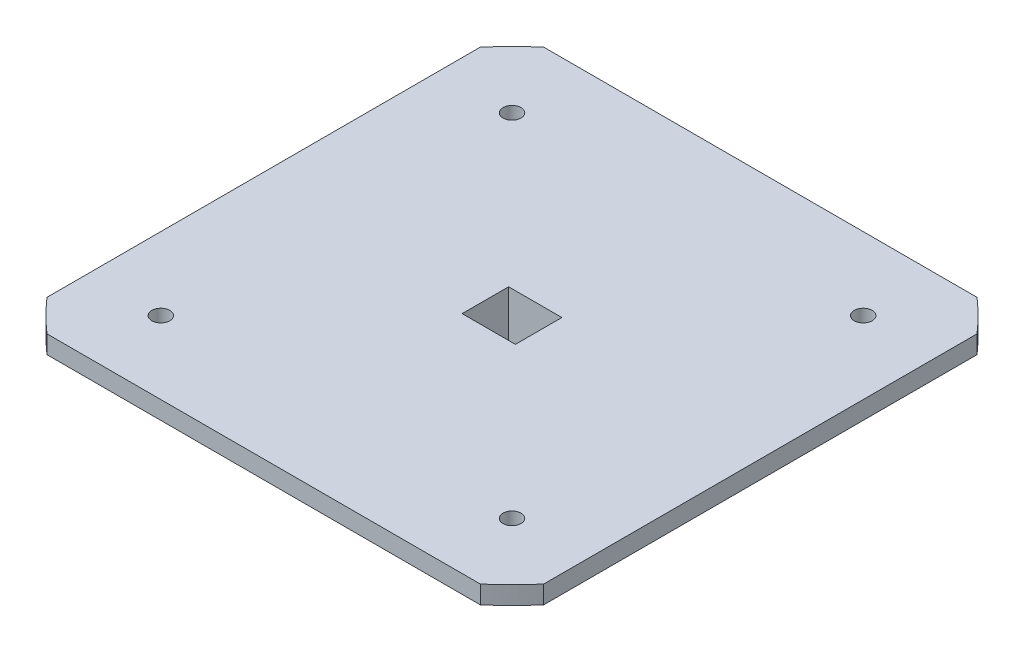
from build123d import *

# Parameters (mm, degrees)
BOSS_EXTRUDE1_DEPTH       = 4
F_4_0MM_DOWEL_HOLE2_D     = 4
SKETCH7_W                 = 11.8
SKETCH7_H                 = 10.3
CUT_EXTRUDE1_DEPTH        = 10
SKETCH8_W                 = 21.8
SKETCH8_H                 = 20.3
SKETCH8_W_2               = 11.8
SKETCH8_H_2               = 10.3
BOSS_EXTRUDE2_DEPTH       = 12
FILLET1_START             = -10.15
FILLET1_DEPTH             = 20.3
FILLET1_START_2           = -12
FILLET1_2_DEPTH           = 24
F_3_0MM_DOWEL_HOLE1_D     = 3
F_3_0MM_DOWEL_HOLE1_DEPTH = 5


with BuildPart() as part:
    # Sketch1 → Boss-Extrude1 (new body)
    with BuildSketch(Plane(origin=(0, 0, 0), x_dir=(1, 0, 0), z_dir=(0, 1, 0))):
        with BuildLine():
            Line((55, 48), (55, -48))
            ThreePointArc((55, -48), (51.618795027, -51.618795027), (48, -55))
            Line((48, -55), (-48, -55))
            ThreePointArc((-48, -55), (-51.618795027, -51.618795027), (-55, -48))
            Line((-55, -48), (-55, 48))
            ThreePointArc((-55, 48), (-51.618795027, 51.618795027), (-48, 55))
            Line((-48, 55), (48, 55))
            ThreePointArc((48, 55), (51.618795027, 51.618795027), (55, 48))
        make_face()
    extrude(amount=BOSS_EXTRUDE1_DEPTH)

    # Ø4.0mm Dowel Hole2 (through all)
    with Locations(Plane(origin=(0, 4, 0), x_dir=(1, 0, 0), z_dir=(0, 1, 0))):
        with Locations((38.890872965, 38.890872965), (38.890872965, -38.890872965), (-38.890872965, -38.890872965), (-38.890872965, 38.890872965)):
            Hole(F_4_0MM_DOWEL_HOLE2_D / 2)

    # Sketch7 → Cut-Extrude1 (cut)
    with BuildSketch(Plane.XZ):
        Rectangle(SKETCH7_W, SKETCH7_H)
    extrude(amount=-CUT_EXTRUDE1_DEPTH, mode=Mode.SUBTRACT)

    # Sketch8 → Boss-Extrude2 (add)
    with BuildSketch(Plane.XZ):
        Rectangle(SKETCH8_W, SKETCH8_H)
        Rectangle(SKETCH8_W_2, SKETCH8_H_2, mode=Mode.SUBTRACT)
    extrude(amount=BOSS_EXTRUDE2_DEPTH)

    # Fillet1: read off the stored shape, not the designer's step
    # Fillet1 outline → Fillet1 (cut)
    with BuildSketch(Plane.XY.offset(FILLET1_START)):
        with BuildLine():
            Line((10.9, -12), (10.9, -7))
            ThreePointArc((10.9, -7), (9.435533906, -10.535533906), (5.9, -12))
            Line((5.9, -12), (10.9, -12))
        make_face()
        with BuildLine():
            Line((-10.9, -12), (-5.9, -12))
            ThreePointArc((-5.9, -12), (-9.435533906, -10.535533906), (-10.9, -7))
            Line((-10.9, -7), (-10.9, -12))
        make_face()
    extrude(amount=FILLET1_DEPTH, mode=Mode.SUBTRACT)

    # Fillet1 2 outline → Fillet1 2 (cut)
    with BuildSketch(Plane.YZ.offset(FILLET1_START_2)):
        with BuildLine():
            ThreePointArc((-12, 5.15), (-10.535533906, 8.685533906), (-7, 10.15))
            Line((-7, 10.15), (-12, 10.15))
            Line((-12, 10.15), (-12, 5.15))
        make_face()
        with BuildLine():
            Line((-12, -10.15), (-7, -10.15))
            ThreePointArc((-7, -10.15), (-10.535533906, -8.685533906), (-12, -5.15))
            Line((-12, -5.15), (-12, -10.15))
        make_face()
    extrude(amount=FILLET1_2_DEPTH, mode=Mode.SUBTRACT)

    # Ø3.0mm Dowel Hole1
    with Locations(Plane(origin=(0, 0, -10.15), x_dir=(-1, 0, 0), z_dir=(0, 0, -1))):
        with Locations((0, -6)):
            Hole(F_3_0MM_DOWEL_HOLE1_D / 2, depth=F_3_0MM_DOWEL_HOLE1_DEPTH)


solid = part.part
